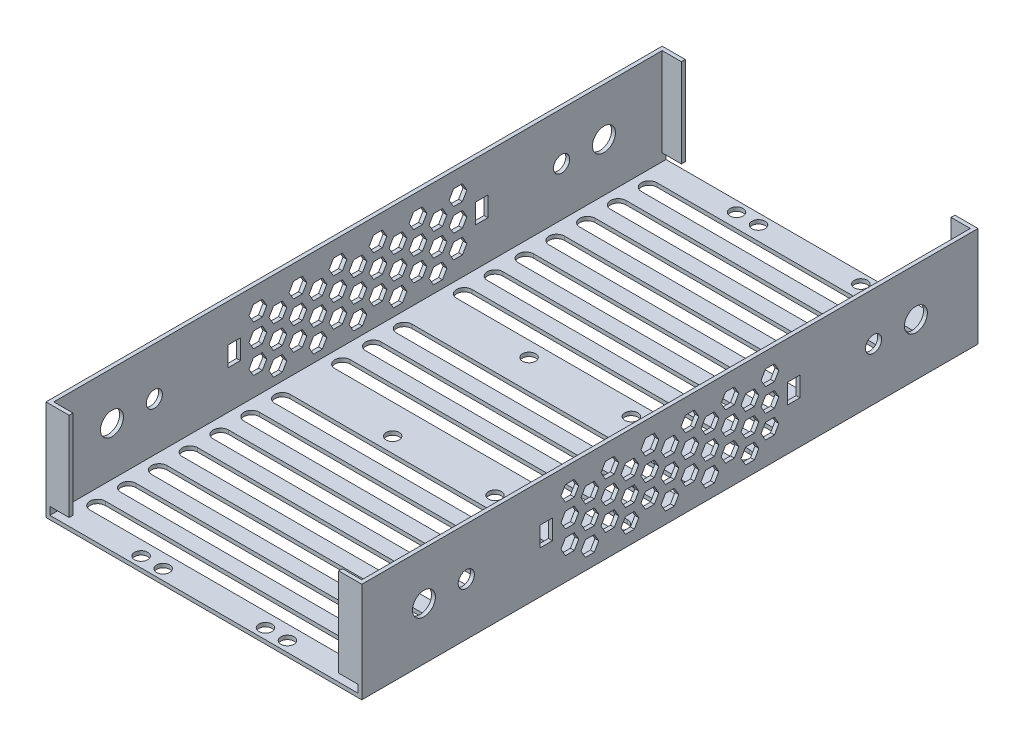
from build123d import *

# Parameters (mm, degrees)
EXTRUDE_START       = 1
SKETCH_1_R          = 1.7
EXTRUDE_1_DEPTH     = 1
SKETCH_3_W          = 160
SKETCH_3_H          = 26
SKETCH_3_R          = 2.98
SKETCH_3_R_2        = 2.1
SKETCH_3_W_2        = 3.245395601
SKETCH_3_H_2        = 5.116955501
EXTRUDE_2_DEPTH     = 1
EXTRUDE_START_2     = -1
SKETCH_11_W         = 160
SKETCH_11_H         = 26
SKETCH_11_R         = 2.98
SKETCH_11_R_2       = 2.1
SKETCH_11_W_2       = 3.245395601
SKETCH_11_H_2       = 5.116955501
EXTRUDE_3_DEPTH     = 1
CUT_EXTRUDE_1_DEPTH = 10
SKETCH_14_W         = 5
SKETCH_14_H         = 23
EXTRUDE_4_DEPTH     = 1
SKETCH_15_W         = 5
SKETCH_15_H         = 23
EXTRUDE_5_DEPTH     = 1
CUT_EXTRUDE_2_DEPTH = 118.698768048


with BuildPart() as part:
    # 草图1 → 凸台-拉伸1 (new body)
    with BuildSketch(Plane(origin=(0, 0, 0), x_dir=(1, 0, 0), z_dir=(0, 1, 0)).offset(EXTRUDE_START)):
        Polygon((-40, 80), (40, 80), (40, -80), (0, -80), (-40, -80), align=None)
        with Locations((-13.28422657, -77.29489459)):
            Circle(SKETCH_1_R, mode=Mode.SUBTRACT)
        with Locations((-13.28422657, -17.70637541)):
            Circle(SKETCH_1_R, mode=Mode.SUBTRACT)
        with Locations((-13.28422657, 77.29489459)):
            Circle(SKETCH_1_R, mode=Mode.SUBTRACT)
        with Locations((-13.28422657, 17.70637541)):
            Circle(SKETCH_1_R, mode=Mode.SUBTRACT)
        with Locations((13.28422657, -77.29489459)):
            Circle(SKETCH_1_R, mode=Mode.SUBTRACT)
        with Locations((13.28422657, -17.70637541)):
            Circle(SKETCH_1_R, mode=Mode.SUBTRACT)
        with Locations((13.28422657, 17.70637541)):
            Circle(SKETCH_1_R, mode=Mode.SUBTRACT)
        with Locations((13.28422657, 77.29489459)):
            Circle(SKETCH_1_R, mode=Mode.SUBTRACT)
        with Locations((19, -77.3)):
            Circle(SKETCH_1_R, mode=Mode.SUBTRACT)
        with Locations((-19, -77.3)):
            Circle(SKETCH_1_R, mode=Mode.SUBTRACT)
        with Locations((19, 77.3)):
            Circle(SKETCH_1_R, mode=Mode.SUBTRACT)
        with Locations((-19, 77.3)):
            Circle(SKETCH_1_R, mode=Mode.SUBTRACT)
    extrude(amount=EXTRUDE_1_DEPTH)

    # 草图3 → 凸台-拉伸2 (add)
    with BuildSketch(Plane(origin=(40, 0, 0), x_dir=(0, 0, -1), z_dir=(1, 0, 0))):
        with Locations((0, 14)):
            Rectangle(SKETCH_3_W, SKETCH_3_H)
        with Locations((-63.873360894, 14.599788345)):
            Circle(SKETCH_3_R, mode=Mode.SUBTRACT)
        with Locations((-52.873360894, 14.599788345)):
            Circle(SKETCH_3_R_2, mode=Mode.SUBTRACT)
        with Locations((52.873360894, 14.599788345)):
            Circle(SKETCH_3_R_2, mode=Mode.SUBTRACT)
        with Locations((63.873360894, 14.599788345)):
            Circle(SKETCH_3_R, mode=Mode.SUBTRACT)
        with Locations((-32.136303875, 14.600665152)):
            Rectangle(SKETCH_3_W_2, SKETCH_3_H_2, mode=Mode.SUBTRACT)
        with Locations((32.136303875, 14.600665152)):
            Rectangle(SKETCH_3_W_2, SKETCH_3_H_2, mode=Mode.SUBTRACT)
    extrude(amount=EXTRUDE_2_DEPTH)

    # 草图11 → 凸台-拉伸3 (add)
    with BuildSketch(Plane(origin=(-40, 0, -40), x_dir=(0, 0, -1), z_dir=(1, 0, 0)).offset(EXTRUDE_START_2)):
        with Locations((-40, 14)):
            Rectangle(SKETCH_11_W, SKETCH_11_H)
        with Locations((-103.873360894, 14.599788345)):
            Circle(SKETCH_11_R, mode=Mode.SUBTRACT)
        with Locations((-92.873360894, 14.599788345)):
            Circle(SKETCH_11_R_2, mode=Mode.SUBTRACT)
        with Locations((12.873360894, 14.599788345)):
            Circle(SKETCH_11_R_2, mode=Mode.SUBTRACT)
        with Locations((23.873360894, 14.599788345)):
            Circle(SKETCH_11_R, mode=Mode.SUBTRACT)
        with Locations((-72.136303875, 14.600665152)):
            Rectangle(SKETCH_11_W_2, SKETCH_11_H_2, mode=Mode.SUBTRACT)
        with Locations((-7.863696126, 14.600665152)):
            Rectangle(SKETCH_11_W_2, SKETCH_11_H_2, mode=Mode.SUBTRACT)
    extrude(amount=EXTRUDE_3_DEPTH)

    # 草图12 → 切除-拉伸1 (cut)
    with BuildSketch(Plane(origin=(0, 0, 0), x_dir=(1, 0, 0), z_dir=(0, 1, 0))):
        with BuildLine():
            Line((36, 61.605861208), (-36, 61.605861208))
            ThreePointArc((-36, 61.605861208), (-38, 63.605861208), (-36, 65.605861208))
            Line((-36, 65.605861208), (36, 65.605861208))
            ThreePointArc((36, 65.605861208), (38, 63.605861208), (36, 61.605861208))
        make_face()
        with BuildLine():
            Line((36, -2), (-36, -2))
            ThreePointArc((-36, -2), (-38, 0), (-36, 2))
            Line((-36, 2), (36, 2))
            ThreePointArc((36, 2), (38, 0), (36, -2))
        make_face()
        with BuildLine():
            Line((36, 69.605861208), (-36, 69.605861208))
            ThreePointArc((-36, 69.605861208), (-38, 71.605861208), (-36, 73.605861208))
            Line((-36, 73.605861208), (36, 73.605861208))
            ThreePointArc((36, 73.605861208), (38, 71.605861208), (36, 69.605861208))
        make_face()
        with BuildLine():
            Line((36, 53.605861208), (-36, 53.605861208))
            ThreePointArc((-36, 53.605861208), (-38, 55.605861208), (-36, 57.605861208))
            Line((-36, 57.605861208), (36, 57.605861208))
            ThreePointArc((36, 57.605861208), (38, 55.605861208), (36, 53.605861208))
        make_face()
        with BuildLine():
            Line((36, 45.605861208), (-36, 45.605861208))
            ThreePointArc((-36, 45.605861208), (-38, 47.605861208), (-36, 49.605861208))
            Line((-36, 49.605861208), (36, 49.605861208))
            ThreePointArc((36, 49.605861208), (38, 47.605861208), (36, 45.605861208))
        make_face()
        with BuildLine():
            Line((36, 37.605861208), (-36, 37.605861208))
            ThreePointArc((-36, 37.605861208), (-38, 39.605861208), (-36, 41.605861208))
            Line((-36, 41.605861208), (36, 41.605861208))
            ThreePointArc((36, 41.605861208), (38, 39.605861208), (36, 37.605861208))
        make_face()
        with BuildLine():
            Line((36, 29.605861208), (-36, 29.605861208))
            ThreePointArc((-36, 29.605861208), (-38, 31.605861208), (-36, 33.605861208))
            Line((-36, 33.605861208), (36, 33.605861208))
            ThreePointArc((36, 33.605861208), (38, 31.605861208), (36, 29.605861208))
        make_face()
        with BuildLine():
            Line((36, 21.605861208), (-36, 21.605861208))
            ThreePointArc((-36, 21.605861208), (-38, 23.605861208), (-36, 25.605861208))
            Line((-36, 25.605861208), (36, 25.605861208))
            ThreePointArc((36, 25.605861208), (38, 23.605861208), (36, 21.605861208))
        make_face()
        with BuildLine():
            Line((36, -61.605861208), (-36, -61.605861208))
            ThreePointArc((-36, -61.605861208), (-38, -63.605861208), (-36, -65.605861208))
            Line((-36, -65.605861208), (36, -65.605861208))
            ThreePointArc((36, -65.605861208), (38, -63.605861208), (36, -61.605861208))
        make_face()
        with BuildLine():
            Line((36, -69.605861208), (-36, -69.605861208))
            ThreePointArc((-36, -69.605861208), (-38, -71.605861208), (-36, -73.605861208))
            Line((-36, -73.605861208), (36, -73.605861208))
            ThreePointArc((36, -73.605861208), (38, -71.605861208), (36, -69.605861208))
        make_face()
        with BuildLine():
            Line((36, -53.605861208), (-36, -53.605861208))
            ThreePointArc((-36, -53.605861208), (-38, -55.605861208), (-36, -57.605861208))
            Line((-36, -57.605861208), (36, -57.605861208))
            ThreePointArc((36, -57.605861208), (38, -55.605861208), (36, -53.605861208))
        make_face()
        with BuildLine():
            Line((36, -45.605861208), (-36, -45.605861208))
            ThreePointArc((-36, -45.605861208), (-38, -47.605861208), (-36, -49.605861208))
            Line((-36, -49.605861208), (36, -49.605861208))
            ThreePointArc((36, -49.605861208), (38, -47.605861208), (36, -45.605861208))
        make_face()
        with BuildLine():
            Line((36, -37.605861208), (-36, -37.605861208))
            ThreePointArc((-36, -37.605861208), (-38, -39.605861208), (-36, -41.605861208))
            Line((-36, -41.605861208), (36, -41.605861208))
            ThreePointArc((36, -41.605861208), (38, -39.605861208), (36, -37.605861208))
        make_face()
        with BuildLine():
            Line((36, -29.605861208), (-36, -29.605861208))
            ThreePointArc((-36, -29.605861208), (-38, -31.605861208), (-36, -33.605861208))
            Line((-36, -33.605861208), (36, -33.605861208))
            ThreePointArc((36, -33.605861208), (38, -31.605861208), (36, -29.605861208))
        make_face()
        with BuildLine():
            Line((36, -21.605861208), (-36, -21.605861208))
            ThreePointArc((-36, -21.605861208), (-38, -23.605861208), (-36, -25.605861208))
            Line((-36, -25.605861208), (36, -25.605861208))
            ThreePointArc((36, -25.605861208), (38, -23.605861208), (36, -21.605861208))
        make_face()
        with BuildLine():
            Line((36, -10), (-36, -10))
            ThreePointArc((-36, -10), (-38, -8), (-36, -6))
            Line((-36, -6), (36, -6))
            ThreePointArc((36, -6), (38, -8), (36, -10))
        make_face()
        with BuildLine():
            Line((36, 6), (-36, 6))
            ThreePointArc((-36, 6), (-38, 8), (-36, 10))
            Line((-36, 10), (36, 10))
            ThreePointArc((36, 10), (38, 8), (36, 6))
        make_face()
    extrude(amount=CUT_EXTRUDE_1_DEPTH, mode=Mode.SUBTRACT)

    # 草图14 → 凸台-拉伸4 (add)
    with BuildSketch(Plane.XY.offset(80)):
        with Locations((-37.5, 15.5)):
            Rectangle(SKETCH_14_W, SKETCH_14_H)
        with Locations((37.5, 15.5)):
            Rectangle(SKETCH_14_W, SKETCH_14_H)
    extrude(amount=-EXTRUDE_4_DEPTH)

    # 草图15 → 凸台-拉伸5 (add)
    with BuildSketch(Plane(origin=(0, 0, -80), x_dir=(-1, 0, 0), z_dir=(0, 0, -1))):
        with Locations((-37.5, 15.5)):
            Rectangle(SKETCH_15_W, SKETCH_15_H)
        with Locations((37.5, 15.5)):
            Rectangle(SKETCH_15_W, SKETCH_15_H)
    extrude(amount=-EXTRUDE_5_DEPTH)

    # 草图17 → 切除-拉伸2 (cut, through all)
    with BuildSketch(Plane(origin=(41, 0, 0), x_dir=(0, 0, -1), z_dir=(1, 0, 0))):
        Polygon((12.701705922, 6), (11.547005384, 8), (9.237604307, 8), (8.082903769, 6), (9.237604307, 4), (11.547005384, 4), align=None)
        Polygon((17.897858345, 9), (16.743157806, 11), (14.43375673, 11), (13.279056191, 9), (14.43375673, 7), (16.743157806, 7), align=None)
        Polygon((23.094010768, 12), (21.939310229, 14), (19.629909152, 14), (18.475208614, 12), (19.629909152, 10), (21.939310229, 10), align=None)
        Polygon((28.29016319, 15), (27.135462652, 17), (24.826061575, 17), (23.671361037, 15), (24.826061575, 13), (27.135462652, 13), align=None)
        Polygon((2.309401077, 6), (1.154700538, 8), (-1.154700538, 8), (-2.309401077, 6), (-1.154700538, 4), (1.154700538, 4), align=None)
        Polygon((7.505553499, 9), (6.350852961, 11), (4.041451884, 11), (2.886751346, 9), (4.041451884, 7), (6.350852961, 7), align=None)
        Polygon((12.701705922, 12), (11.547005384, 14), (9.237604307, 14), (8.082903769, 12), (9.237604307, 10), (11.547005384, 10), align=None)
        Polygon((17.897858345, 15), (16.743157806, 17), (14.43375673, 17), (13.279056191, 15), (14.43375673, 13), (16.743157806, 13), align=None)
        Polygon((23.094010768, 18), (21.939310229, 20), (19.629909152, 20), (18.475208614, 18), (19.629909152, 16), (21.939310229, 16), align=None)
        Polygon((2.309401077, 12), (1.154700538, 14), (-1.154700538, 14), (-2.309401077, 12), (-1.154700538, 10), (1.154700538, 10), align=None)
        Polygon((7.505553499, 15), (6.350852961, 17), (4.041451884, 17), (2.886751346, 15), (4.041451884, 13), (6.350852961, 13), align=None)
        Polygon((12.701705922, 18), (11.547005384, 20), (9.237604307, 20), (8.082903769, 18), (9.237604307, 16), (11.547005384, 16), align=None)
        Polygon((17.897858345, 21), (16.743157806, 23), (14.43375673, 23), (13.279056191, 21), (14.43375673, 19), (16.743157806, 19), align=None)
        Polygon((2.309401077, 18), (1.154700538, 20), (-1.154700538, 20), (-2.309401077, 18), (-1.154700538, 16), (1.154700538, 16), align=None)
        Polygon((7.505553499, 21), (6.350852961, 23), (4.041451884, 23), (2.886751346, 21), (4.041451884, 19), (6.350852961, 19), align=None)
        Polygon((28.29016319, 21), (27.135462652, 23), (24.826061575, 23), (23.671361037, 21), (24.826061575, 19), (27.135462652, 19), align=None)
        Polygon((-27.135462652, 7), (-28.29016319, 9), (-27.135462652, 11), (-24.826061575, 11), (-23.671361037, 9), (-24.826061575, 7), align=None)
        Polygon((-21.939310229, 4), (-23.094010768, 6), (-21.939310229, 8), (-19.629909152, 8), (-18.475208614, 6), (-19.629909152, 4), align=None)
        Polygon((23.094010768, 6), (21.939310229, 8), (19.629909152, 8), (18.475208614, 6), (19.629909152, 4), (21.939310229, 4), align=None)
        Polygon((28.29016319, 9), (27.135462652, 11), (24.826061575, 11), (23.671361037, 9), (24.826061575, 7), (27.135462652, 7), align=None)
        Polygon((-27.135462652, 19), (-28.29016319, 21), (-27.135462652, 23), (-24.826061575, 23), (-23.671361037, 21), (-24.826061575, 19), align=None)
        Polygon((-6.350852961, 19), (-7.505553499, 21), (-6.350852961, 23), (-4.041451884, 23), (-2.886751346, 21), (-4.041451884, 19), align=None)
        Polygon((-16.743157806, 19), (-17.897858345, 21), (-16.743157806, 23), (-14.43375673, 23), (-13.279056191, 21), (-14.43375673, 19), align=None)
        Polygon((-11.547005384, 16), (-12.701705922, 18), (-11.547005384, 20), (-9.237604307, 20), (-8.082903769, 18), (-9.237604307, 16), align=None)
        Polygon((-6.350852961, 13), (-7.505553499, 15), (-6.350852961, 17), (-4.041451884, 17), (-2.886751346, 15), (-4.041451884, 13), align=None)
        Polygon((-21.939310229, 16), (-23.094010768, 18), (-21.939310229, 20), (-19.629909152, 20), (-18.475208614, 18), (-19.629909152, 16), align=None)
        Polygon((-16.743157806, 13), (-17.897858345, 15), (-16.743157806, 17), (-14.43375673, 17), (-13.279056191, 15), (-14.43375673, 13), align=None)
        Polygon((-11.547005384, 10), (-12.701705922, 12), (-11.547005384, 14), (-9.237604307, 14), (-8.082903769, 12), (-9.237604307, 10), align=None)
        Polygon((-6.350852961, 7), (-7.505553499, 9), (-6.350852961, 11), (-4.041451884, 11), (-2.886751346, 9), (-4.041451884, 7), align=None)
        Polygon((-27.135462652, 13), (-28.29016319, 15), (-27.135462652, 17), (-24.826061575, 17), (-23.671361037, 15), (-24.826061575, 13), align=None)
        Polygon((-21.939310229, 10), (-23.094010768, 12), (-21.939310229, 14), (-19.629909152, 14), (-18.475208614, 12), (-19.629909152, 10), align=None)
        Polygon((-16.743157806, 7), (-17.897858345, 9), (-16.743157806, 11), (-14.43375673, 11), (-13.279056191, 9), (-14.43375673, 7), align=None)
        Polygon((-11.547005384, 4), (-12.701705922, 6), (-11.547005384, 8), (-9.237604307, 8), (-8.082903769, 6), (-9.237604307, 4), align=None)
    extrude(amount=-CUT_EXTRUDE_2_DEPTH, mode=Mode.SUBTRACT)


solid = part.part
